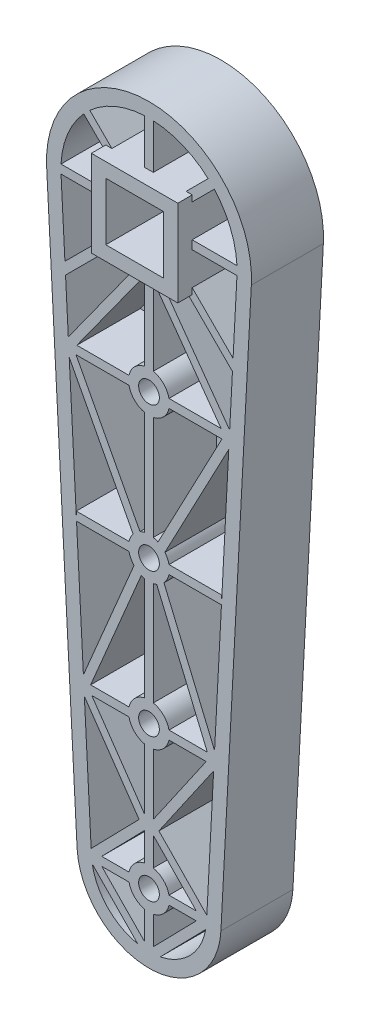
from build123d import *

# Parameters (mm, degrees)
SKETCH1_W           = 20
SKETCH1_H           = 20
BOSS_EXTRUDE1_DEPTH = 25
SKETCH2_W           = 30
SKETCH2_H           = 30
CUT_EXTRUDE1_DEPTH  = 22
SKETCH3_W           = 20.575
SKETCH3_H           = 3
SKETCH3_W_2         = 3
SKETCH3_H_2         = 20.575
SKETCH3_H_3         = 210
BOSS_EXTRUDE3_DEPTH = 22
BOSS_EXTRUDE4_DEPTH = 22
SKETCH7_W           = 30
SKETCH7_H           = 30
SKETCH7_W_2         = 20
SKETCH7_H_2         = 20
BOSS_EXTRUDE5_DEPTH = 5
SKETCH8_R           = 3.6
CUT_EXTRUDE2_DEPTH  = 230.762008663
SKETCH9_R           = 3.6
SKETCH9_R_2         = 7.1
BOSS_EXTRUDE6_DEPTH = 22
SKETCH10_W          = 22.524834301
SKETCH10_H          = 3
SKETCH10_W_2        = 21.634332432
SKETCH10_W_3        = 17.288794661
SKETCH10_W_4        = 14.274524477
BOSS_EXTRUDE7_DEPTH = 22
SKETCH11_R          = 6.25
CUT_EXTRUDE3_DEPTH  = 1.2
CHAMFER1_SIZE       = 1


with BuildPart() as part:
    # Sketch1 → Boss-Extrude1 (new body)
    with BuildSketch(Plane.XY):
        with BuildLine():
            Line((-35.525235512, -1.881028125), (-24.96502847, -201.321875))
            ThreePointArc((-24.96502847, -201.321875), (0, -225), (24.96502847, -201.321875))
            Line((24.96502847, -201.321875), (35.525235512, -1.881028125))
            ThreePointArc((35.525235512, -1.881028125), (0, 35.575), (-35.525235512, -1.881028125))
        make_face()
        Rectangle(SKETCH1_W, SKETCH1_H, mode=Mode.SUBTRACT)
    extrude(amount=BOSS_EXTRUDE1_DEPTH)

    # Sketch2 → Cut-Extrude1 (cut)
    with BuildSketch(Plane.XY.offset(25)):
        with BuildLine():
            Line((-30.532229818, -1.616653125), (-19.972022776, -201.0575))
            ThreePointArc((-19.972022776, -201.0575), (0, -220), (19.972022776, -201.0575))
            Line((19.972022776, -201.0575), (30.532229818, -1.616653125))
            ThreePointArc((30.532229818, -1.616653125), (0, 30.575), (-30.532229818, -1.616653125))
        make_face()
        Rectangle(SKETCH2_W, SKETCH2_H, mode=Mode.SUBTRACT)
    extrude(amount=-CUT_EXTRUDE1_DEPTH, mode=Mode.SUBTRACT)

    # Sketch3 → Boss-Extrude3 (add)
    with BuildSketch(Plane.XY.offset(25)):
        Polygon((-8.939339828, 11.060660172), (-20.559129663, 22.680450007), (-22.680450007, 20.559129663), (-11.060660172, 8.939339828), align=None)
        with Locations((-20.2875, 0)):
            Rectangle(SKETCH3_W, SKETCH3_H)
        with Locations((0, 20.2875)):
            Rectangle(SKETCH3_W_2, SKETCH3_H_2)
        with Locations((20.2875, 0)):
            Rectangle(SKETCH3_W, SKETCH3_H)
        with Locations((0, -115)):
            Rectangle(SKETCH3_W_2, SKETCH3_H_3)
        Polygon((11.060660172, 8.939339828), (22.680450007, 20.559129663), (20.559129663, 22.680450007), (8.939339828, 11.060660172), align=None)
        Polygon((8.939339828, -11.060660172), (28.971494515, -31.092814858), (31.092814858, -28.971494515), (11.060660172, -8.939339828), align=None)
        Polygon((-11.060660172, -8.939339828), (-31.092814858, -28.971494515), (-28.971494515, -31.092814858), (-8.939339828, -11.060660172), align=None)
    extrude(amount=-BOSS_EXTRUDE3_DEPTH)

    # Sketch6 → Boss-Extrude4 (add)
    with BuildSketch(Plane.XY.offset(25)):
        Polygon((-0.283211593, -15.877169295), (-2.716788407, -14.122830705), (-29.646328313, -51.478848713), (-3.158221033, -101.673132803), (-24.292554273, -151.776635357), (-3.436305818, -181.981496761), (-22.069521074, -201.058207654), (-2.572352615, -220.992508064), (-0.427647385, -218.894833286), (-17.874524477, -201.056792346), (-0.426939915, -183.193931755), (-1.5, -182.145818186), (-0.265664409, -181.293517975), (-20.888794661, -151.426267768), (0, -101.90486746), (-0.158221033, -101.529770322), (0, -101.229945522), (-26.124834301, -51.724054412), align=None)
        Polygon((26.124834301, -51.724054412), (0, -101.229945522), (0.158221033, -101.529770322), (0, -101.90486746), (20.888794661, -151.426267768), (0.265664409, -181.293517975), (1.5, -182.145818186), (0.426939915, -183.193931755), (17.874524477, -201.056792346), (0.427647385, -218.894833286), (2.572352615, -220.992508064), (22.069521074, -201.058207654), (3.436305818, -181.981496761), (24.292554273, -151.776635357), (3.158221033, -101.673132803), (29.646328313, -51.478848713), (2.716788407, -14.122830705), (0.283211593, -15.877169295), align=None)
    extrude(amount=-BOSS_EXTRUDE4_DEPTH)

    # Sketch7 → Boss-Extrude5 (add)
    with BuildSketch(Plane.XY.offset(25)):
        Rectangle(SKETCH7_W, SKETCH7_H)
        Rectangle(SKETCH7_W_2, SKETCH7_H_2, mode=Mode.SUBTRACT)
    extrude(amount=BOSS_EXTRUDE5_DEPTH)

    # Sketch8 → Cut-Extrude2 (cut, through all)
    with BuildSketch(Plane(origin=(0, 0, 0), x_dir=(-1, 0, 0), z_dir=(0, 0, -1))):
        with Locations((0, -101.673132803)):
            Circle(SKETCH8_R)
        with Locations((0, -151.426267768)):
            Circle(SKETCH8_R)
        with Locations((0, -201.056792346)):
            Circle(SKETCH8_R)
        with Locations((0, -51.724054412)):
            Circle(SKETCH8_R)
    extrude(amount=-CUT_EXTRUDE2_DEPTH, mode=Mode.SUBTRACT)

    # Sketch9 → Boss-Extrude6 (add)
    # profile 1 of 7: a face of its own
    with BuildSketch(Plane.XY.offset(3)):
        with BuildLine():
            ThreePointArc((1.5, -48.451440778), (3.029851482, -49.779832202), (3.6, -51.724054412))
            ThreePointArc((3.6, -51.724054412), (3.029851482, -53.668276622), (1.5, -54.996668046))
            Line((1.5, -54.996668046), (1.5, -58.663795041))
            ThreePointArc((1.5, -58.663795041), (5.525395913, -56.182753774), (7.1, -51.724054412))
            ThreePointArc((7.1, -51.724054412), (5.525395913, -47.26535505), (1.5, -44.784313783))
            Line((1.5, -44.784313783), (1.5, -48.451440778))
        make_face()
    # profile 2 of 7: a face of its own
    with BuildSketch(Plane.XY.offset(3)):
        with BuildLine():
            Line((1.5, -98.387483985), (1.5, -94.733392174))
            ThreePointArc((1.5, -94.733392174), (-5.525395913, -106.131832165), (7.1, -101.673132803))
            ThreePointArc((7.1, -101.673132803), (6.02611777, -97.918681496), (3.129322643, -95.299959355))
            Line((3.129322643, -95.299959355), (1.5, -98.387483985))
        make_face()
        with Locations(Location((0, -101.673132803, 0), (0, 0, 180))):
            Circle(SKETCH9_R, mode=Mode.SUBTRACT)
    # profile 3 of 7: a face of its own
    with BuildSketch(Plane.XY.offset(3)):
        with BuildLine():
            ThreePointArc((1.5, -48.451440778), (3.029851482, -49.779832202), (3.6, -51.724054412))
            ThreePointArc((3.6, -51.724054412), (3.029851482, -53.668276622), (1.5, -54.996668046))
            Line((1.5, -54.996668046), (1.5, -58.663795041))
            ThreePointArc((1.5, -58.663795041), (5.525395913, -56.182753774), (7.1, -51.724054412))
            ThreePointArc((7.1, -51.724054412), (5.525395913, -47.26535505), (1.5, -44.784313783))
            Line((1.5, -44.784313783), (1.5, -48.451440778))
        make_face()
    # profile 4 of 7: a face of its own
    with BuildSketch(Plane.XY.offset(3)):
        with BuildLine():
            ThreePointArc((1.5, -54.996668046), (-3.6, -51.724054412), (1.5, -48.451440778))
            Line((1.5, -48.451440778), (1.5, -44.784313783))
            ThreePointArc((1.5, -44.784313783), (-7.1, -51.724054412), (1.5, -58.663795041))
            Line((1.5, -58.663795041), (1.5, -54.996668046))
        make_face()
    # profile 5 of 7: a face of its own
    with BuildSketch(Plane.XY.offset(3)):
        with BuildLine():
            ThreePointArc((3.129322643, -95.299959355), (2.331931951, -94.96700923), (1.5, -94.733392174))
            Line((1.5, -94.733392174), (1.5, -98.387483985))
            Line((1.5, -98.387483985), (3.129322643, -95.299959355))
        make_face()
    # profile 6 of 7: a face of its own
    with BuildSketch(Plane.XY.offset(3)):
        with Locations((0, -151.426267768)):
            Circle(SKETCH9_R_2)
        with Locations(Location((0, -151.426267768, 0), (0, 0, 180))):
            Circle(SKETCH9_R, mode=Mode.SUBTRACT)
    # profile 7 of 7: a face of its own
    with BuildSketch(Plane.XY.offset(3)):
        with Locations((0, -201.056792346)):
            Circle(SKETCH9_R_2)
        with Locations(Location((0, -201.056792346, 0), (0, 0, 180))):
            Circle(SKETCH9_R, mode=Mode.SUBTRACT)
    extrude(amount=BOSS_EXTRUDE6_DEPTH)

    # Sketch10 → Boss-Extrude7 (add)
    with BuildSketch(Plane.XY.offset(25)):
        with Locations((-14.862417151, -51.724054412)):
            Rectangle(SKETCH10_W, SKETCH10_H)
        with Locations((14.862417151, -51.724054412)):
            Rectangle(SKETCH10_W, SKETCH10_H)
        with Locations((-14.417166216, -101.673132803)):
            Rectangle(SKETCH10_W_2, SKETCH10_H)
        with Locations((14.417166216, -101.673132803)):
            Rectangle(SKETCH10_W_2, SKETCH10_H)
        with Locations((-12.244397331, -151.426267768)):
            Rectangle(SKETCH10_W_3, SKETCH10_H)
        with Locations((12.244397331, -151.426267768)):
            Rectangle(SKETCH10_W_3, SKETCH10_H)
        with Locations((-10.737262239, -201.056792346)):
            Rectangle(SKETCH10_W_4, SKETCH10_H)
        with Locations((10.737262239, -201.056792346)):
            Rectangle(SKETCH10_W_4, SKETCH10_H)
    extrude(amount=-BOSS_EXTRUDE7_DEPTH)

    # Sketch11 → Cut-Extrude3 (cut)
    with BuildSketch(Plane(origin=(0, 0, 0), x_dir=(-1, 0, 0), z_dir=(0, 0, -1))):
        with Locations((0, -51.724054412)):
            Circle(SKETCH11_R)
        with Locations((0, -101.673132803)):
            Circle(SKETCH11_R)
        with Locations((0, -151.426267768)):
            Circle(SKETCH11_R)
        with Locations((0, -201.056792346)):
            Circle(SKETCH11_R)
    extrude(amount=-CUT_EXTRUDE3_DEPTH, mode=Mode.SUBTRACT)

    # Chamfer1
    # the kernel refuses this chamfer: 1 mm, written as the material it takes off along each edge
    with BuildSketch(Plane(origin=(0, -51.724054412, 1.2), x_dir=(-1, 0, 0), z_dir=(0, -1, 0))) as chamfer1_piece_1:
        Polygon((3.6, -CHAMFER1_SIZE), (3.6 + CHAMFER1_SIZE, 0), (3.6, 0), align=None)
    revolve(axis=Axis((0, -51.724054412, 1.2), (0, 0, -1)), mode=Mode.SUBTRACT)
    with BuildSketch(Plane(origin=(0, -101.673132803, 1.2), x_dir=(-1, 0, 0), z_dir=(0, -1, 0))) as chamfer1_piece_2:
        Polygon((3.6, -CHAMFER1_SIZE), (3.6 + CHAMFER1_SIZE, 0), (3.6, 0), align=None)
    revolve(axis=Axis((0, -101.673132803, 1.2), (0, 0, -1)), mode=Mode.SUBTRACT)
    with BuildSketch(Plane(origin=(0, -151.426267768, 1.2), x_dir=(-1, 0, 0), z_dir=(0, -1, 0))) as chamfer1_piece_3:
        Polygon((3.6, -CHAMFER1_SIZE), (3.6 + CHAMFER1_SIZE, 0), (3.6, 0), align=None)
    revolve(axis=Axis((0, -151.426267768, 1.2), (0, 0, -1)), mode=Mode.SUBTRACT)
    with BuildSketch(Plane(origin=(0, -201.056792346, 1.2), x_dir=(-1, 0, 0), z_dir=(0, -1, 0))) as chamfer1_piece_4:
        Polygon((3.6, -CHAMFER1_SIZE), (3.6 + CHAMFER1_SIZE, 0), (3.6, 0), align=None)
    revolve(axis=Axis((0, -201.056792346, 1.2), (0, 0, -1)), mode=Mode.SUBTRACT)


solid = part.part
